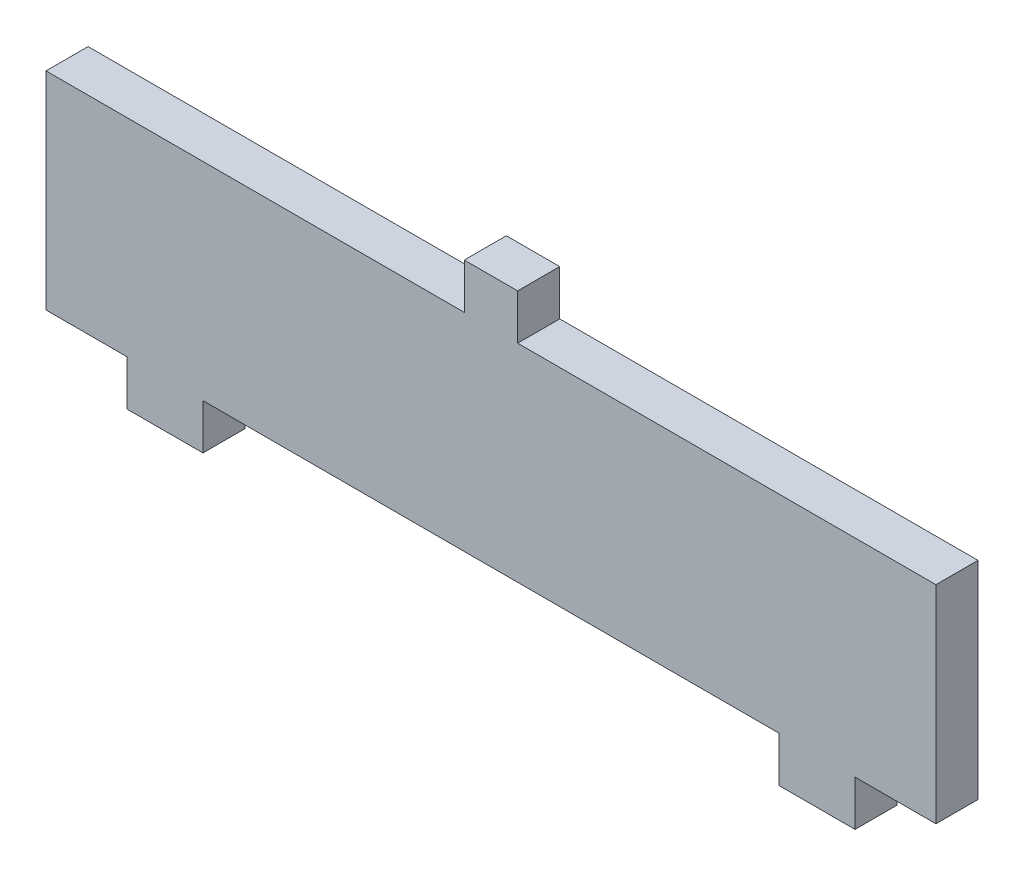
from build123d import *

# Parameters (mm, degrees)
BASE_FLANGE1_DEPTH = 2.6


# Sheet-metal steps are written as plain solids
with BuildPart() as part:
    # Sketch1 → Base-Flange1 (new body)
    with BuildSketch(Plane.XY):
        Polygon((-27.5, 0), (-22.5, 0), (-22.5, -2.8), (-17.8, -2.8), (-17.8, 0), (17.8, 0), (17.8, -2.8), (22.5, -2.8), (22.5, 0), (27.5, 0), (27.5, 12.8), (1.65, 12.8), (1.65, 15.6), (-1.65, 15.6), (-1.65, 12.8), (-27.5, 12.8), align=None)
    extrude(amount=-BASE_FLANGE1_DEPTH)


solid = part.part
